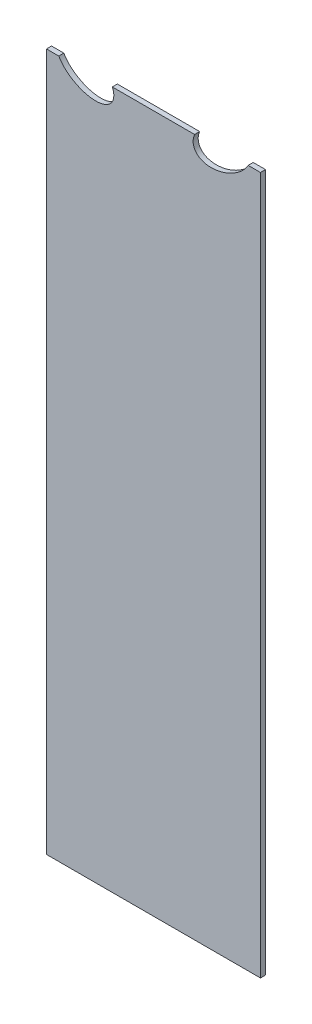
from build123d import *

# Parameters (mm, degrees)
BOSS_EXTRUDE1_OUTLINE_W = 127
BOSS_EXTRUDE1_OUTLINE_H = 508
BOSS_EXTRUDE1_DEPTH     = 3
SKETCH2_W               = 127
SKETCH2_H               = 93.98
CLEARANCE_DEPTH         = 512.962156917


# Read off the part's stored shape, not the designer's step: Boss-Extrude1
with BuildPart() as part:
    # Boss-Extrude1 outline → Boss-Extrude1 (new body)
    with BuildSketch(Plane.XY):
        with Locations((0, 254)):
            Rectangle(BOSS_EXTRUDE1_OUTLINE_W, BOSS_EXTRUDE1_OUTLINE_H)
        with BuildLine():
            add(Edge.make_bspline(
                [(-24.248447896, 406.835785182), (-24.020490126, 407.314748566), (-23.664729979, 408.320343277), (-23.462175176, 410.200931921), (-23.759442829, 412.367496281), (-24.97473491, 415.592555217), (-28.359599913, 420.118436778), (-35.635403135, 425.052654423), (-44.053113042, 427.587605354), (-49.700172647, 427.360376803), (-52.969485775, 426.269720281), (-54.838384763, 425.134120988), (-56.170139269, 423.790963502), (-57.004245667, 422.425575267), (-57.537885889, 420.9171832), (-57.740440691, 419.036594556), (-57.443173039, 416.870030196), (-56.227880958, 413.644971261), (-52.843015955, 409.119089699), (-45.567212732, 404.184872054), (-37.149502826, 401.649921123), (-31.502443221, 401.877149674), (-28.233130092, 402.967806196), (-26.364231105, 404.10340549), (-25.032476598, 405.446562975), (-24.476405666, 406.356821798), (-24.248447896, 406.835785182)],
                knots=[0, 0, 0, 0, 0.03125, 0.0625, 0.09375, 0.125, 0.1875, 0.25, 0.3125, 0.375, 0.40625, 0.4375, 0.46875, 0.5, 0.53125, 0.5625, 0.59375, 0.625, 0.6875, 0.75, 0.8125, 0.875, 0.90625, 0.9375, 0.96875, 1, 1, 1, 1], degree=3))
        make_face(mode=Mode.SUBTRACT)
        with BuildLine():
            add(Edge.make_bspline(
                [(56.954167971, 422.401741295), (56.726210201, 422.880704679), (56.170139269, 423.790963502), (54.838384763, 425.134120988), (52.969485775, 426.269720281), (49.700172647, 427.360376803), (44.053113042, 427.587605354), (35.635403135, 425.052654423), (28.359599913, 420.118436778), (24.97473491, 415.592555217), (23.759442829, 412.367496281), (23.462175176, 410.200931921), (23.664729979, 408.320343277), (24.1983702, 406.81195121), (25.032476598, 405.446562975), (26.364231105, 404.10340549), (28.233130092, 402.967806196), (31.502443221, 401.877149674), (37.149502826, 401.649921123), (45.567212732, 404.184872054), (52.843015955, 409.119089699), (56.227880958, 413.644971261), (57.443173039, 416.870030196), (57.740440691, 419.036594556), (57.537885889, 420.9171832), (57.182125741, 421.922777912), (56.954167971, 422.401741295)],
                knots=[0, 0, 0, 0, 0.03125, 0.0625, 0.09375, 0.125, 0.1875, 0.25, 0.3125, 0.375, 0.40625, 0.4375, 0.46875, 0.5, 0.53125, 0.5625, 0.59375, 0.625, 0.6875, 0.75, 0.8125, 0.875, 0.90625, 0.9375, 0.96875, 1, 1, 1, 1], degree=3))
        make_face(mode=Mode.SUBTRACT)
    extrude(amount=BOSS_EXTRUDE1_DEPTH)

    # Sketch2 → Clearance (cut, through all)
    with BuildSketch(Plane.XY.offset(3)):
        with Locations((0, 461.01)):
            Rectangle(SKETCH2_W, SKETCH2_H)
    extrude(amount=-CLEARANCE_DEPTH, mode=Mode.SUBTRACT)


solid = part.part
